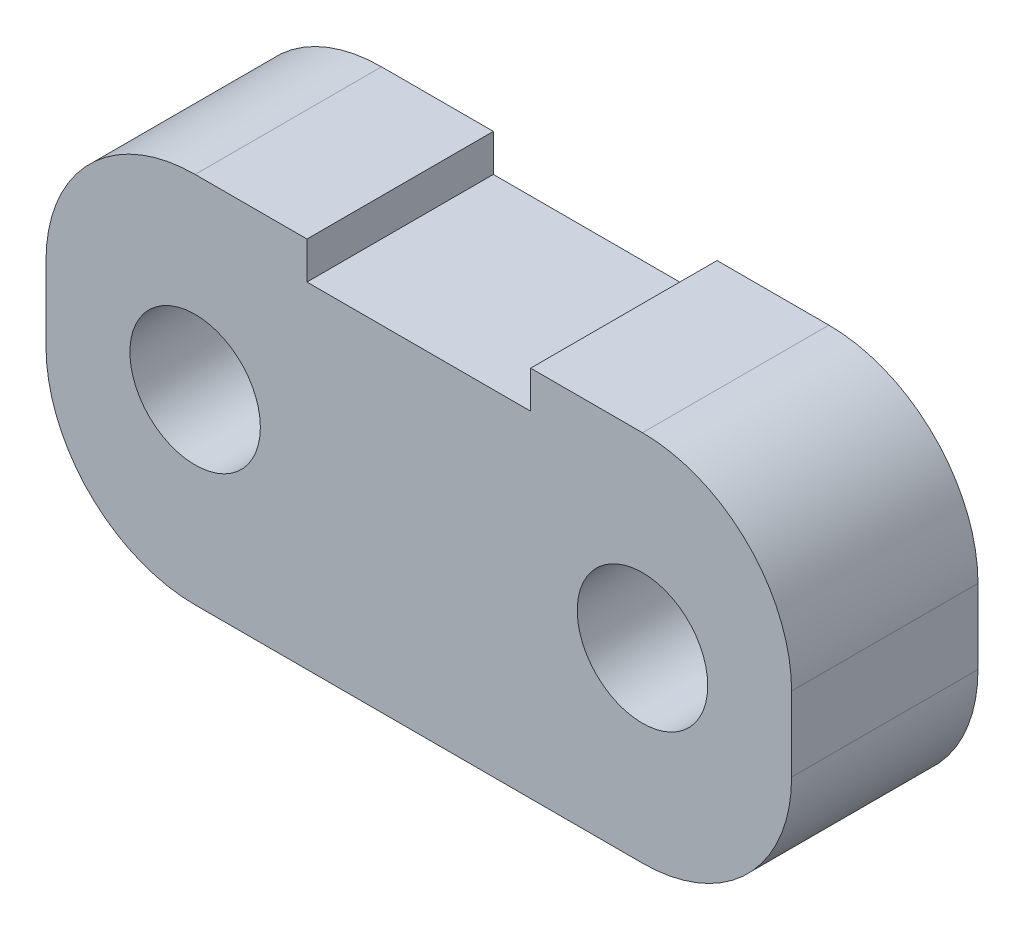
from build123d import *

# Parameters (mm, degrees)
SKETCH1_R           = 1.75
BOSS_EXTRUDE1_DEPTH = 5
SKETCH2_W           = 6
SKETCH2_H           = 1
BOSS_EXTRUDE2_DEPTH = 1
FILLET1_START       = -3
FILLET1_DEPTH       = 6
FILLET1_2_DEPTH     = 6


with BuildPart() as part:
    # Sketch1 → Boss-Extrude1 (new body)
    with BuildSketch(Plane.XY):
        with BuildLine():
            Line((-6, 5), (-3, 5))
            Line((-3, 5), (-3, 4))
            Line((-3, 4), (3, 4))
            Line((3, 4), (3, 5))
            Line((3, 5), (6, 5))
            ThreePointArc((6, 5), (8.828427125, 3.828427125), (10, 1))
            Line((10, 1), (10, -1))
            ThreePointArc((10, -1), (8.828427125, -3.828427125), (6, -5))
            Line((6, -5), (-6, -5))
            ThreePointArc((-6, -5), (-8.828427125, -3.828427125), (-10, -1))
            Line((-10, -1), (-10, 1))
            ThreePointArc((-10, 1), (-8.828427125, 3.828427125), (-6, 5))
        make_face()
        with Locations((6, 0)):
            Circle(SKETCH1_R, mode=Mode.SUBTRACT)
        with Locations((-6, 0)):
            Circle(SKETCH1_R, mode=Mode.SUBTRACT)
    extrude(amount=BOSS_EXTRUDE1_DEPTH)

    # Sketch2 → Boss-Extrude2 (add)
    with BuildSketch(Plane(origin=(0, 0, 0), x_dir=(-1, 0, 0), z_dir=(0, 0, -1))):
        with Locations((0, 2.5)):
            Rectangle(SKETCH2_W, SKETCH2_H)
        with Locations((0, 0.5)):
            Rectangle(SKETCH2_W, SKETCH2_H)
        with Locations((0, -1.5)):
            Rectangle(SKETCH2_W, SKETCH2_H)
        with Locations((0, -3.5)):
            Rectangle(SKETCH2_W, SKETCH2_H)
    extrude(amount=BOSS_EXTRUDE2_DEPTH)

    # Fillet1: read off the stored shape, not the designer's step
    # Fillet1 outline → Fillet1 (cut)
    with BuildSketch(Plane.YZ.offset(FILLET1_START)):
        with BuildLine():
            ThreePointArc((-3.5, -1), (-3.853553391, -0.853553391), (-4, -0.5))
            Line((-4, -0.5), (-4, -1))
            Line((-4, -1), (-3.5, -1))
        make_face()
        with BuildLine():
            ThreePointArc((-3, -0.5), (-3.146446609, -0.853553391), (-3.5, -1))
            Line((-3.5, -1), (-3, -1))
            Line((-3, -1), (-3, -0.5))
        make_face()
        with BuildLine():
            ThreePointArc((-1.5, -1), (-1.853553391, -0.853553391), (-2, -0.5))
            Line((-2, -0.5), (-2, -1))
            Line((-2, -1), (-1.5, -1))
        make_face()
        with BuildLine():
            ThreePointArc((-1, -0.5), (-1.146446609, -0.853553391), (-1.5, -1))
            Line((-1.5, -1), (-1, -1))
            Line((-1, -1), (-1, -0.5))
        make_face()
        with BuildLine():
            ThreePointArc((0.5, -1), (0.146446609, -0.853553391), (0, -0.5))
            Line((0, -0.5), (0, -1))
            Line((0, -1), (0.5, -1))
        make_face()
        with BuildLine():
            ThreePointArc((1, -0.5), (0.853553391, -0.853553391), (0.5, -1))
            Line((0.5, -1), (1, -1))
            Line((1, -1), (1, -0.5))
        make_face()
        with BuildLine():
            ThreePointArc((2.5, -1), (2.146446609, -0.853553391), (2, -0.5))
            Line((2, -0.5), (2, -1))
            Line((2, -1), (2.5, -1))
        make_face()
        with BuildLine():
            ThreePointArc((3, -0.5), (2.853553391, -0.853553391), (2.5, -1))
            Line((2.5, -1), (3, -1))
            Line((3, -1), (3, -0.5))
        make_face()
    extrude(amount=FILLET1_DEPTH, mode=Mode.SUBTRACT)

    # Fillet1 2 outline → Fillet1 2 (add)
    with BuildSketch(Plane.YZ.offset(FILLET1_START)):
        with BuildLine():
            Line((-4, 0), (-4.5, 0))
            ThreePointArc((-4.5, 0), (-4.146446609, -0.146446609), (-4, -0.5))
            Line((-4, -0.5), (-4, 0))
        make_face()
        with BuildLine():
            Line((2, 0), (1.5, 0))
            ThreePointArc((1.5, 0), (1.853553391, -0.146446609), (2, -0.5))
            Line((2, -0.5), (2, 0))
        make_face()
        with BuildLine():
            Line((0, 0), (-0.5, 0))
            ThreePointArc((-0.5, 0), (-0.146446609, -0.146446609), (0, -0.5))
            Line((0, -0.5), (0, 0))
        make_face()
        with BuildLine():
            Line((-2, 0), (-2.5, 0))
            ThreePointArc((-2.5, 0), (-2.146446609, -0.146446609), (-2, -0.5))
            Line((-2, -0.5), (-2, 0))
        make_face()
        with BuildLine():
            Line((-2.5, 0), (-3, 0))
            Line((-3, 0), (-3, -0.5))
            ThreePointArc((-3, -0.5), (-2.853553391, -0.146446609), (-2.5, 0))
        make_face()
        with BuildLine():
            Line((-0.5, 0), (-1, 0))
            Line((-1, 0), (-1, -0.5))
            ThreePointArc((-1, -0.5), (-0.853553391, -0.146446609), (-0.5, 0))
        make_face()
        with BuildLine():
            Line((1.5, 0), (1, 0))
            Line((1, 0), (1, -0.5))
            ThreePointArc((1, -0.5), (1.146446609, -0.146446609), (1.5, 0))
        make_face()
        with BuildLine():
            Line((3.5, 0), (3, 0))
            Line((3, 0), (3, -0.5))
            ThreePointArc((3, -0.5), (3.146446609, -0.146446609), (3.5, 0))
        make_face()
    extrude(amount=FILLET1_2_DEPTH)


solid = part.part
